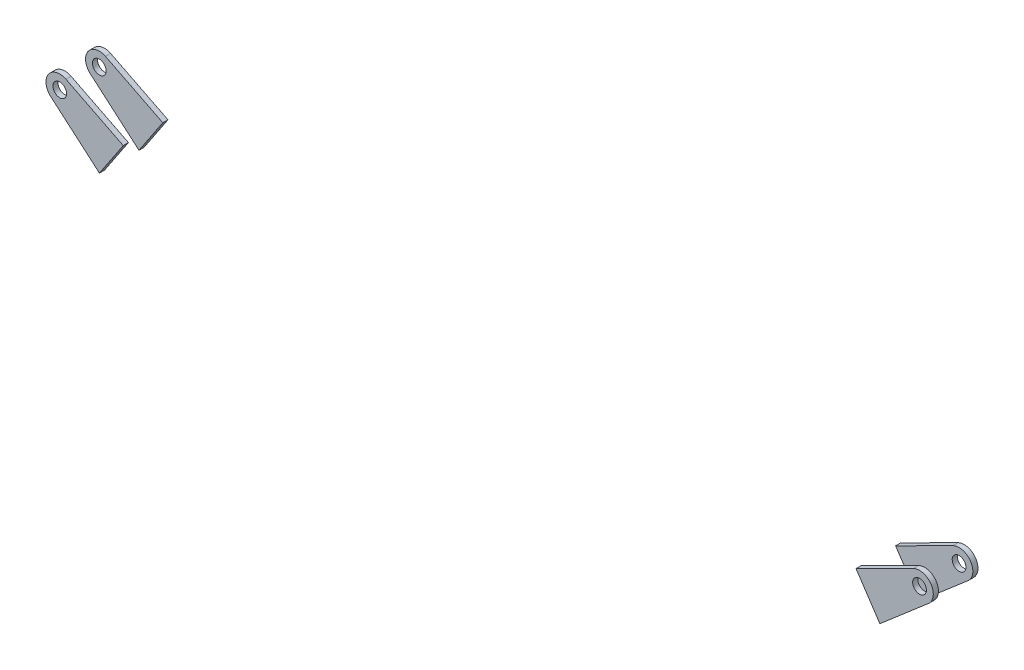
from build123d import *

# Parameters (mm, degrees)
BOSS_EXTRUDE1_START     = 142
BOSS_EXTRUDE1_OUTLINE_R = 4
BOSS_EXTRUDE1_DEPTH     = 3


# Read off the part's stored shape, not the designer's step: Boss-Extrude1
with BuildPart() as part:
    # Boss-Extrude1 outline → Boss-Extrude1 (new body)
    with BuildSketch(Plane.XY.offset(BOSS_EXTRUDE1_START)):
        with BuildLine():
            Line((226.933752453, -2260.400628679), (255.217810768, -2236.064194158))
            ThreePointArc((255.217810768, -2236.064194158), (256.656402355, -2225.56239843), (246.409132611, -2222.851176922))
            Line((246.409132611, -2222.851176922), (213.066247547, -2239.599371321))
            Line((213.066247547, -2239.599371321), (226.933752453, -2260.400628679))
        make_face()
        with Locations((250, -2230)):
            Circle(BOSS_EXTRUDE1_OUTLINE_R, mode=Mode.SUBTRACT)
    extrude(amount=BOSS_EXTRUDE1_DEPTH)


with BuildPart() as body_2:
    # Mirror1: mirrored copy
    add(part.part.mirror(Plane(origin=(0, 0, 132), x_dir=(1, 0, 0), z_dir=(0, 0, -1))))


with BuildPart() as body_3:
    # Mirror2: mirrored copy
    add(part.part.mirror(Plane(origin=(0, 0, 0), x_dir=(0, 0, 1), z_dir=(1, 0, 0))))


with BuildPart() as body_4:
    # Mirror2 2: mirrored copy
    add(body_2.part.mirror(Plane(origin=(0, 0, 0), x_dir=(0, 0, 1), z_dir=(1, 0, 0))))


solid = Compound([part.part, body_2.part, body_3.part, body_4.part])
